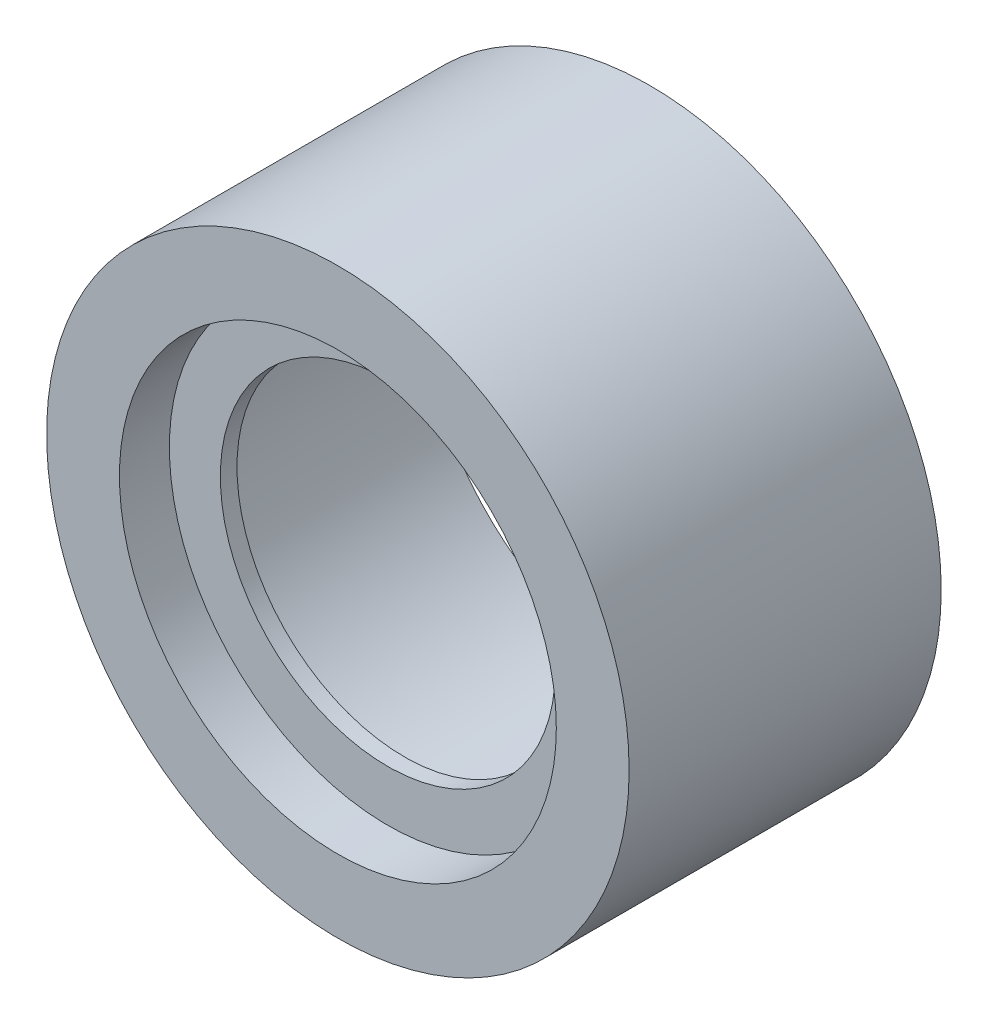
from build123d import *

# Parameters (mm, degrees)
SKETCH2_R                  = 4
CUT_EXTRUDE1_DEPTH         = 10
M8X1_25_TAPPED_HOLE1_D     = 6.8
M8X1_25_TAPPED_HOLE1_DEPTH = 10
M8X1_25_TAPPED_HOLE1_TIP   = 2.042926105


with BuildPart() as part:
    # Sketch1 → Revolve1 (revolve)
    with BuildSketch(Plane(origin=(0, 0, 0), x_dir=(0, 0, -1), z_dir=(1, 0, 0))):
        Polygon((-84.79575879, 52.5), (-72.79575879, 52.5), (-72.79575879, 40.25), (-68.79575879, 40.25), (-68.79575879, 55), (-9.79575879, 55), (-9.79575879, 70), (-84.79575879, 70), align=None)
    revolve(axis=Axis((0, 0, 163.822734484), (0, 0, -1)))

    # Sketch2 → Cut-Extrude1 (cut)
    with BuildSketch(Plane(origin=(0, 0, 9.79575879), x_dir=(-1, 0, 0), z_dir=(0, 0, -1))):
        with Locations((0, 62.5)):
            Circle(SKETCH2_R)
        with Locations((0, -62.5)):
            Circle(SKETCH2_R)
    extrude(amount=-CUT_EXTRUDE1_DEPTH, mode=Mode.SUBTRACT)

    # M8x1.25 Tapped Hole1
    with Locations(Plane(origin=(0, 0, 9.79575879), x_dir=(-1, 0, 0), z_dir=(0, 0, -1))):
        with Locations((62.5, 0), (-44.194173824, 44.194173824), (44.194173824, -44.194173824), (-62.5, 0), (44.194173824, 44.194173824), (-44.194173824, -44.194173824)):
            Hole(M8X1_25_TAPPED_HOLE1_D / 2, depth=M8X1_25_TAPPED_HOLE1_DEPTH)
            with Locations((0, 0, -(M8X1_25_TAPPED_HOLE1_DEPTH + M8X1_25_TAPPED_HOLE1_TIP / 2))):  # 118° drill point
                Cone(0, M8X1_25_TAPPED_HOLE1_D / 2, M8X1_25_TAPPED_HOLE1_TIP, mode=Mode.SUBTRACT)


solid = part.part
